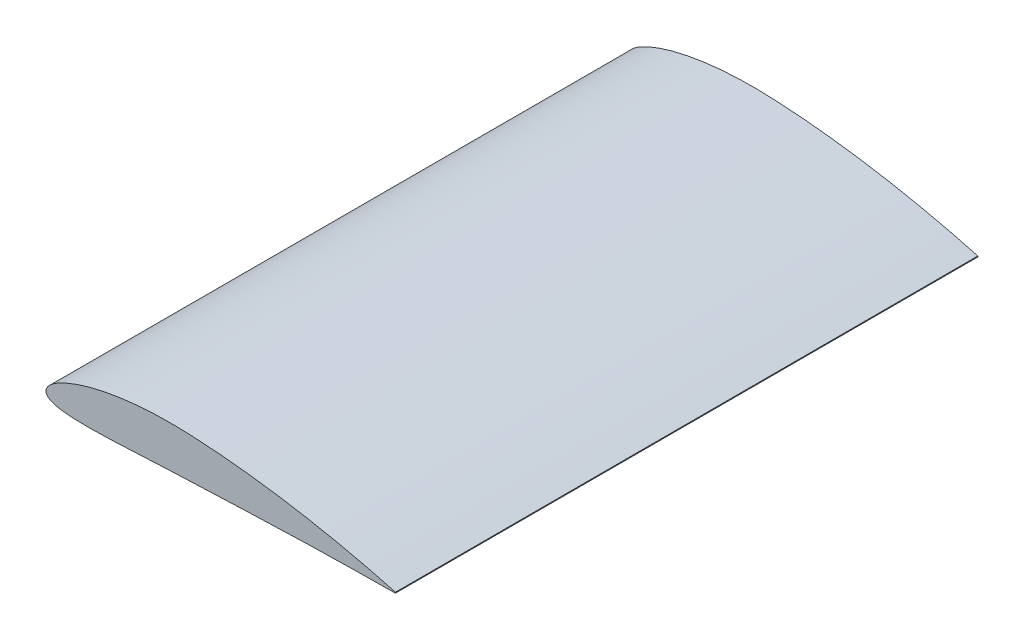
from build123d import *

# Parameters (mm, degrees)
EXTRUDE_1_DEPTH = 250


with BuildPart() as part:
    # Эскиз1 → Бобышка-Вытянуть1 (new, symmetric)
    with BuildSketch(Plane.XY):
        with BuildLine():
            Line((0.05757, 0.74571), (0, 0))
            Line((0, 0), (0.00249, -0.14724))
            add(Edge.make_bspline(
                [(0.00249, -0.14724), (0.028864169, -0.445513844), (0.08330578, -1.0612113), (0.42267139, -1.966638227), (0.976281815, -2.838072896), (1.756459788, -3.647133325), (2.749077941, -4.393198402), (3.967143746, -5.082935859), (5.442296909, -5.728408867), (7.235698246, -6.338630634), (9.442776227, -6.918379999), (12.202598128, -7.466059916), (15.690525654, -7.967542476), (20.073738499, -8.391548086), (25.427942493, -8.696814173), (31.679981306, -8.851966619), (38.636878275, -8.851508296), (46.077368111, -8.713723896), (53.829146121, -8.46796963), (61.783851715, -8.143744238), (69.877177119, -7.766789504), (78.062513527, -7.359422717), (86.292927251, -6.940806212), (94.525650691, -6.527616544), (102.732598332, -6.133141503), (110.918529108, -5.765943991), (119.106037428, -5.438377986), (127.316854086, -5.133929605), (135.563054016, -4.803707911), (143.837285105, -4.467811421), (152.128632568, -4.128080756), (160.417875856, -3.790434721), (168.698244489, -3.458856865), (176.966416514, -3.13670755), (185.223122893, -2.826751698), (193.470052961, -2.531243905), (201.709043695, -2.251960889), (209.941894226, -1.990371725), (218.170315159, -1.747653748), (226.395881355, -1.524460053), (234.619974201, -1.321335461), (242.843439472, -1.138340626), (253.799028348, -0.921290824), (264.723718399, -0.743927691), (275.541156207, -0.603511416), (283.304824625, -0.51781703), (290.376932295, -0.451824554), (295.870764013, -0.407443063), (298.944589157, -0.385525491), (300, -0.378)],
                knots=[0, 0, 0, 0, 0.002951555, 0.006092605, 0.0094509, 0.013105035, 0.017145832, 0.021696099, 0.026921577, 0.033052787, 0.04041788, 0.049480062, 0.060872195, 0.075263112, 0.093030359, 0.113913711, 0.137122623, 0.161846788, 0.187529051, 0.213844768, 0.24060404, 0.267679501, 0.294919064, 0.322129352, 0.349224887, 0.376200636, 0.403190533, 0.430285051, 0.457482609, 0.484832061, 0.51220601, 0.539574277, 0.566902094, 0.594185889, 0.621429901, 0.648639753, 0.675821648, 0.702981565, 0.730124952, 0.757257324, 0.784383539, 0.811507209, 0.838628701, 0.892783781, 0.919594556, 0.94565005, 0.969591155, 0.989558995, 1, 1, 1, 1], degree=3))
            ThreePointArc((300, -0.378), (300.156572727, 0), (300, 0.378))
            add(Edge.make_bspline(
                [(300, 0.378), (298.986801288, 0.654023781), (296.064210837, 1.450219491), (290.8695985, 2.830006863), (284.219713445, 4.545150437), (276.935901935, 6.357610605), (269.347101537, 8.175439233), (261.636652195, 9.949932759), (253.874886054, 11.663682068), (246.086893811, 13.310849919), (238.281565095, 14.889420872), (230.462843896, 16.398357509), (222.633143967, 17.836911964), (214.794406789, 19.204085734), (206.94847769, 20.498865738), (199.097180514, 21.719793409), (191.242416875, 22.865402178), (183.386166154, 23.933862723), (175.530527282, 24.923138619), (167.67763175, 25.830811336), (159.830204076, 26.654405099), (151.990419631, 27.390865714), (144.164125102, 28.036767919), (136.354280569, 28.589612789), (128.583278445, 29.040291112), (120.889314832, 29.398079412), (113.294103258, 29.623979722), (105.787101592, 29.68811478), (98.338851666, 29.590618972), (90.93662471, 29.32921657), (83.58443153, 28.898261785), (76.290492602, 28.293607633), (69.066227461, 27.50993599), (61.926915226, 26.542878626), (54.893280374, 25.387877318), (47.995029113, 24.042445667), (41.277503811, 22.507579481), (34.812458524, 20.793138729), (28.71095809, 18.926237906), (23.124814608, 16.961123321), (18.21491807, 14.980002525), (14.088570948, 13.074733194), (10.751246243, 11.315492838), (8.113069416, 9.730323839), (6.040451698, 8.309565666), (4.40603392, 7.025075597), (3.110521348, 5.845566442), (2.085810802, 4.743114892), (1.283844996, 3.697135648), (0.685974492, 2.689946523), (0.258928679, 1.716942476), (0.122706698, 1.059890033), (0.05757, 0.74571)],
                knots=[0, 0, 0, 0, 0.0101622, 0.029313053, 0.052011605, 0.076619468, 0.101948061, 0.127526132, 0.153184131, 0.178867888, 0.204557903, 0.230245712, 0.255925967, 0.281594302, 0.30724642, 0.332878042, 0.358484538, 0.384061186, 0.409602822, 0.435103874, 0.460559416, 0.485959195, 0.51130307, 0.536551515, 0.561723366, 0.586628867, 0.611085431, 0.6352512, 0.659272176, 0.683163753, 0.706922144, 0.73053591, 0.7539832, 0.77723469, 0.800246382, 0.822950709, 0.845237155, 0.866915896, 0.887662335, 0.906968281, 0.924203157, 0.938878975, 0.950931611, 0.960693484, 0.968646729, 0.975232933, 0.980794744, 0.985583761, 0.989781539, 0.993521313, 0.996902113, 1, 1, 1, 1], degree=3))
        make_face()
    extrude(amount=EXTRUDE_1_DEPTH, both=True)


solid = part.part
